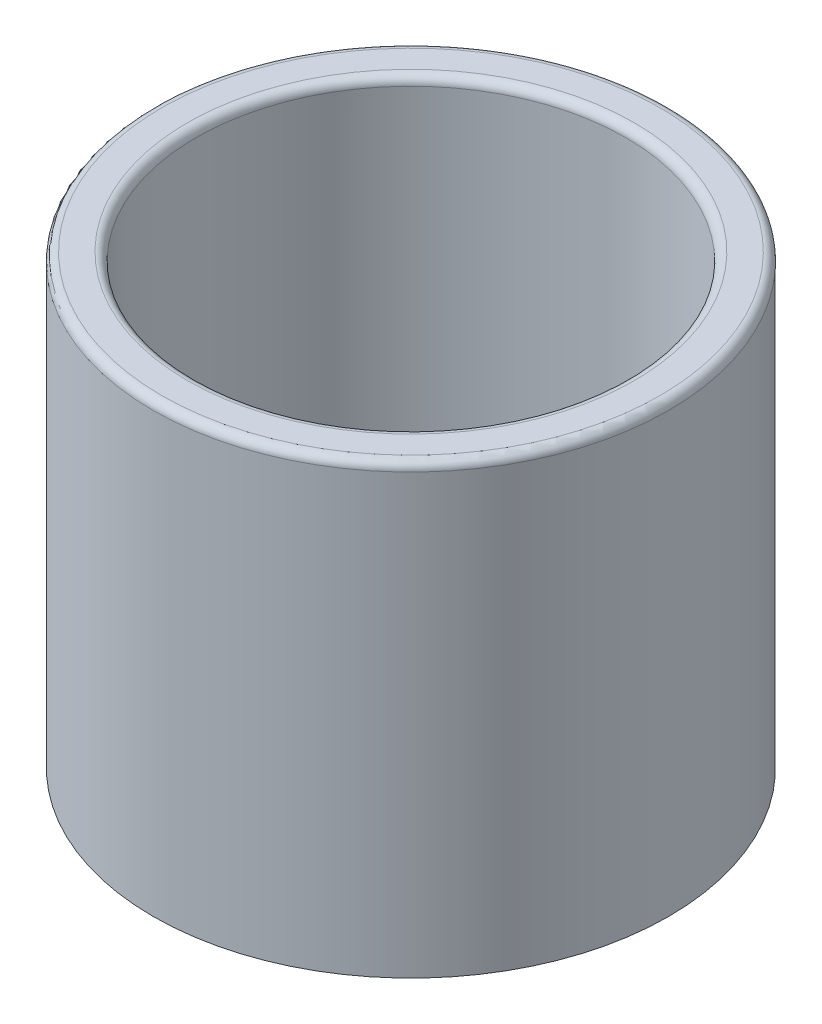
from build123d import *

# Parameters (mm, degrees)
SKETCH1_R           = 30
SKETCH1_R_2         = 25
BOSS_EXTRUDE1_DEPTH = 50
BOSS_EXTRUDE2_START = 2
SKETCH2_R           = 30
BOSS_EXTRUDE2_DEPTH = 2
FILLET1_R           = 1


with BuildPart() as part:
    # Sketch1 → Boss-Extrude1 (new body)
    with BuildSketch(Plane(origin=(0, 0, 0), x_dir=(1, 0, 0), z_dir=(0, 1, 0))):
        Circle(SKETCH1_R)
        Circle(SKETCH1_R_2, mode=Mode.SUBTRACT)
    extrude(amount=BOSS_EXTRUDE1_DEPTH)

    # Sketch2 → Boss-Extrude2 (add)
    with BuildSketch(Plane.XZ.offset(BOSS_EXTRUDE2_START)):
        Circle(SKETCH2_R)
    extrude(amount=-BOSS_EXTRUDE2_DEPTH)

    # Fillet1
    fillet1_edges = [part.edges().sort_by_distance(p)[0] for p in [
        (-25, 0, 0),
        (-25, 50, 0),
        (-30, 50, 0),
    ]]
    fillet(fillet1_edges, radius=FILLET1_R)


solid = part.part
